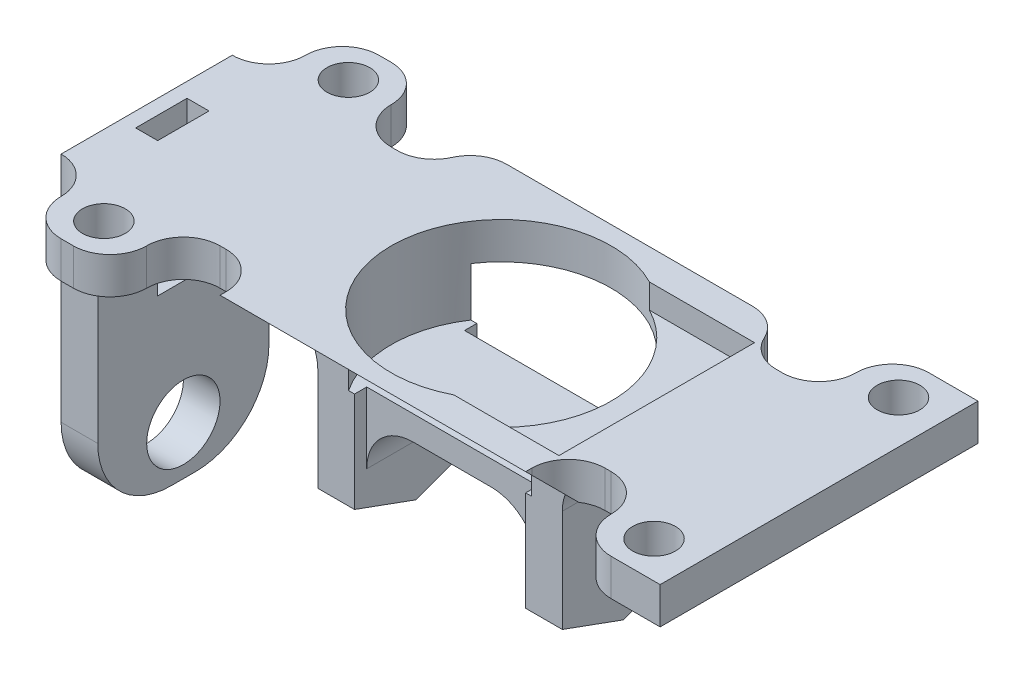
from build123d import *
from OCP.BRepFilletAPI import BRepFilletAPI_MakeChamfer

# Parameters (mm, degrees)
SKETCH1_W           = 3
SKETCH1_H           = 14
BOSS_EXTRUDE1_DEPTH = 25
SKETCH2_R           = 3
CUT_EXTRUDE1_DEPTH  = 27.134268691
SKETCH3_W           = 14
SKETCH3_H           = 3
BOSS_EXTRUDE2_DEPTH = 52
SKETCH4_W           = 3
SKETCH4_H           = 10
BOSS_EXTRUDE3_DEPTH = 14
CHAMFER1_SIZE       = 1.819851171
CHAMFER1_SIZE_2     = 5
SKETCH6_W           = 25
SKETCH6_H           = 3
BOSS_EXTRUDE5_DEPTH = 3.5
SKETCH5_W           = 7
SKETCH5_H           = 3
BOSS_EXTRUDE4_DEPTH = 6
SKETCH7_R           = 9
CUT_EXTRUDE2_DEPTH  = 7
CHAMFER2_SIZE       = 3
SKETCH8_W           = 8
SKETCH8_H           = 2
BOSS_EXTRUDE6_DEPTH = 14
SKETCH9_W           = 8.6
SKETCH9_H           = 16
CUT_EXTRUDE3_DEPTH  = 2
CUT_EXTRUDE4_REACH  = 62.467
SKETCH10_R          = 1.75
SKETCH11_W          = 1.8
SKETCH11_H          = 4.2
CUT_EXTRUDE5_DEPTH  = 11
FILLET1_R           = 3
FILLET2_R           = 3
FILLET3_R           = 3.8
FILLET4_R           = 6


# Some blends are built 0.0001 mm under size
with BuildPart() as part:
    # Sketch1 → Boss-Extrude1 (new body)
    with BuildSketch(Plane(origin=(0, 0, 0), x_dir=(1, 0, 0), z_dir=(0, 1, 0))):
        Rectangle(SKETCH1_W, SKETCH1_H)
    extrude(amount=BOSS_EXTRUDE1_DEPTH)

    # Sketch2 → Cut-Extrude1 (cut, through all)
    with BuildSketch(Plane.ZY.offset(1.5)):
        with Locations((0, 4)):
            Circle(SKETCH2_R)
    extrude(amount=-CUT_EXTRUDE1_DEPTH, mode=Mode.SUBTRACT)

    # Sketch3 → Boss-Extrude2 (add)
    with BuildSketch(Plane(origin=(1.5, 0, 0), x_dir=(0, 0, -1), z_dir=(1, 0, 0))):
        with Locations((0, 23.5)):
            Rectangle(SKETCH3_W, SKETCH3_H)
    extrude(amount=BOSS_EXTRUDE2_DEPTH)

    # Sketch4 → Boss-Extrude3 (add)
    with BuildSketch(Plane.XZ.offset(-22)):
        with Locations((36, 0)):
            Rectangle(SKETCH4_W, SKETCH4_H)
        with Locations((19, 0)):
            Rectangle(SKETCH4_W, SKETCH4_H)
    extrude(amount=BOSS_EXTRUDE3_DEPTH)

    # Chamfer1
    chamfer1_edges_1 = [part.edges().sort_by_distance(p)[0] for p in [
        (36, 8, -5),
    ]]
    chamfer1_side_1 = [part.faces().sort_by_distance(p)[0] for p in [
        (36, 8.036397023, -5),
    ]]
    chamfer1_edges_2 = [part.edges().sort_by_distance(p)[0] for p in [
        (36, 8, 5),
    ]]
    chamfer1_side_2 = [part.faces().sort_by_distance(p)[0] for p in [
        (36, 8.036397023, 5),
    ]]
    chamfer1_edges_3 = [part.edges().sort_by_distance(p)[0] for p in [
        (19, 8, 5),
    ]]
    chamfer1_side_3 = [part.faces().sort_by_distance(p)[0] for p in [
        (19, 8.036397023, 5),
    ]]
    chamfer1_edges_4 = [part.edges().sort_by_distance(p)[0] for p in [
        (19, 8, -5),
    ]]
    chamfer1_side_4 = [part.faces().sort_by_distance(p)[0] for p in [
        (19, 8.036397023, -5),
    ]]
    chamfer1 = BRepFilletAPI_MakeChamfer(part.part.solid().wrapped)
    for e in chamfer1_edges_1:
        chamfer1.Add(CHAMFER1_SIZE - 0.0001, CHAMFER1_SIZE_2 - 0.0001, e.wrapped, chamfer1_side_1[0].wrapped)
    for e in chamfer1_edges_2:
        chamfer1.Add(CHAMFER1_SIZE - 0.0001, CHAMFER1_SIZE_2 - 0.0001, e.wrapped, chamfer1_side_2[0].wrapped)
    for e in chamfer1_edges_3:
        chamfer1.Add(CHAMFER1_SIZE - 0.0001, CHAMFER1_SIZE_2 - 0.0001, e.wrapped, chamfer1_side_3[0].wrapped)
    for e in chamfer1_edges_4:
        chamfer1.Add(CHAMFER1_SIZE - 0.0001, CHAMFER1_SIZE_2 - 0.0001, e.wrapped, chamfer1_side_4[0].wrapped)
    add(Compound.cast(chamfer1.Shape()), mode=Mode.REPLACE)  # a hair under: the kernel refuses the full size

    # Sketch6 → Boss-Extrude5 (add)
    with BuildSketch(Plane(origin=(0, 0, -7), x_dir=(-1, 0, 0), z_dir=(0, 0, -1))):
        with Locations((-27.5, 23.5)):
            Rectangle(SKETCH6_W, SKETCH6_H)
    boss_extrude5 = extrude(amount=BOSS_EXTRUDE5_DEPTH)

    # Sketch5 → Boss-Extrude4 (add)
    with BuildSketch(Plane.XY.offset(7)):
        with Locations((5, 23.5)):
            Rectangle(SKETCH5_W, SKETCH5_H)
        with Locations((50, 23.5)):
            Rectangle(SKETCH5_W, SKETCH5_H)
    boss_extrude4 = extrude(amount=BOSS_EXTRUDE4_DEPTH)

    # Mirror1: Boss-Extrude5, Boss-Extrude4 across plane
    add(boss_extrude5.mirror(Plane.XY))
    add(boss_extrude4.mirror(Plane.XY))

    # Sketch7 → Cut-Extrude2 (cut)
    with BuildSketch(Plane(origin=(0, 25, 0), x_dir=(1, 0, 0), z_dir=(0, 1, 0))):
        with Locations(Location((27.5, 0, 0), (0, 0, 270))):
            Circle(SKETCH7_R)
    extrude(amount=-CUT_EXTRUDE2_DEPTH, mode=Mode.SUBTRACT)

    # Chamfer2
    # the kernel refuses this chamfer: 3 mm, written as the material it takes off along each edge
    with BuildSketch(Plane(origin=(15, 22, 10.5), x_dir=(0, -0.027495876610587926, -0.9996219169112968), z_dir=(1, 0, 0))) as chamfer2_piece_1:
        Polygon((CHAMFER2_SIZE * 0.999621916911, CHAMFER2_SIZE * 0.0274958766106), (-CHAMFER2_SIZE * 0.0274958766106, CHAMFER2_SIZE * 0.999621916911), (0, 0), align=None)
    extrude(amount=25, mode=Mode.SUBTRACT)

    # Sketch8 → Boss-Extrude6 (add)
    with BuildSketch(Plane(origin=(20.5, 0, 0), x_dir=(0, 0, -1), z_dir=(1, 0, 0))):
        with Locations((0, 17)):
            Rectangle(SKETCH8_W, SKETCH8_H)
    extrude(amount=BOSS_EXTRUDE6_DEPTH)

    # Sketch9 → Cut-Extrude3 (cut)
    with BuildSketch(Plane(origin=(0, 25, 0), x_dir=(1, 0, 0), z_dir=(0, 1, 0))):
        with Locations((35.923105626, 0)):
            Rectangle(SKETCH9_W, SKETCH9_H)
    extrude(amount=-CUT_EXTRUDE3_DEPTH, mode=Mode.SUBTRACT)

    # Sketch10 → Cut-Extrude4 (cut, up to next)
    with BuildSketch(Plane(origin=(0, 25, 0), x_dir=(1, 0, 0), z_dir=(0, 1, 0)), mode=Mode.PRIVATE) as cut_extrude4_sk1:
        with Locations(Location((5, -10, 0), (0, 0, 270))):
            Circle(SKETCH10_R)
    cut_extrude4_tool1 = extrude(cut_extrude4_sk1.sketch, amount=-CUT_EXTRUDE4_REACH, mode=Mode.PRIVATE) & part.part
    # Sketch10 → Cut-Extrude4 (cut, up to next)
    with BuildSketch(Plane(origin=(0, 25, 0), x_dir=(1, 0, 0), z_dir=(0, 1, 0)), mode=Mode.PRIVATE) as cut_extrude4_sk2:
        with Locations(Location((50, -10, 0), (0, 0, 270))):
            Circle(SKETCH10_R)
    cut_extrude4_tool2 = extrude(cut_extrude4_sk2.sketch, amount=-CUT_EXTRUDE4_REACH, mode=Mode.PRIVATE) & part.part
    # Sketch10 → Cut-Extrude4 (cut, up to next)
    with BuildSketch(Plane(origin=(0, 25, 0), x_dir=(1, 0, 0), z_dir=(0, 1, 0)), mode=Mode.PRIVATE) as cut_extrude4_sk3:
        with Locations(Location((50, 10, 0), (0, 0, 270))):
            Circle(SKETCH10_R)
    cut_extrude4_tool3 = extrude(cut_extrude4_sk3.sketch, amount=-CUT_EXTRUDE4_REACH, mode=Mode.PRIVATE) & part.part
    # Sketch10 → Cut-Extrude4 (cut, up to next)
    with BuildSketch(Plane(origin=(0, 25, 0), x_dir=(1, 0, 0), z_dir=(0, 1, 0)), mode=Mode.PRIVATE) as cut_extrude4_sk4:
        with Locations(Location((5, 10, 0), (0, 0, 270))):
            Circle(SKETCH10_R)
    cut_extrude4_tool4 = extrude(cut_extrude4_sk4.sketch, amount=-CUT_EXTRUDE4_REACH, mode=Mode.PRIVATE) & part.part
    add(cut_extrude4_tool1.solids().sort_by_distance((5, 25, 10))[0], mode=Mode.SUBTRACT)
    add(cut_extrude4_tool2.solids().sort_by_distance((50, 25, 10))[0], mode=Mode.SUBTRACT)
    add(cut_extrude4_tool3.solids().sort_by_distance((50, 25, -10))[0], mode=Mode.SUBTRACT)
    add(cut_extrude4_tool4.solids().sort_by_distance((5, 25, -10))[0], mode=Mode.SUBTRACT)

    # Sketch11 → Cut-Extrude5 (cut)
    with BuildSketch(Plane(origin=(0, 25, 0), x_dir=(1, 0, 0), z_dir=(0, 1, 0))):
        with Locations((0.6, 0)):
            Rectangle(SKETCH11_W, SKETCH11_H)
    extrude(amount=-CUT_EXTRUDE5_DEPTH, mode=Mode.SUBTRACT)

    # Fillet1
    # the kernel refuses this fillet: 3 mm, written as the material it adds along each edge
    with BuildSketch(Plane(origin=(46.5, 22, 7), x_dir=(0, 0, 1), z_dir=(0, 1, 0)), Plane(origin=(8.5, 25, 7), x_dir=(0, 0, 1), z_dir=(0, -1, 0)), Plane(origin=(1.5, 22, 7), x_dir=(0, 0, 1), z_dir=(0, 1, 0)), Plane(origin=(46.5, 22, -7), x_dir=(-1, 0, 0), z_dir=(0, 1, 0))) as fillet1_piece_1:
        with BuildLine():
            CenterArc((FILLET1_R, -FILLET1_R), FILLET1_R, 90, 90)
            Line((0, -FILLET1_R), (0, 0))
            Line((0, 0), (FILLET1_R, 0))
        make_face()
    extrude(amount=3)
    with BuildSketch(Plane(origin=(40, 22, 7), x_dir=(1, 0, 0), z_dir=(0, 1, 0))) as fillet1_piece_2_section:
        with BuildLine():
            CenterArc((FILLET1_R, -FILLET1_R), FILLET1_R, 90, 90)
            Line((0, -FILLET1_R), (0, 0))
            Line((0, 0), (FILLET1_R, 0))
        make_face()
    fillet1_piece_2 = extrude(amount=8.5, mode=Mode.PRIVATE)
    fillet1_piece_2 = split(fillet1_piece_2, bisect_by=Plane(origin=(40.974089344, 22.187586332, 7.687586332), z_dir=(0, 0.7071067811862648, -0.7071067811868302)), keep=Keep.TOP, mode=Mode.PRIVATE)
    fillet1_piece_2 = split(fillet1_piece_2, bisect_by=Plane(origin=(40.974089344, 25, 7.348410065), z_dir=(0, -1, 0)), keep=Keep.TOP, mode=Mode.PRIVATE)
    fillet1_piece_2 = split(fillet1_piece_2, bisect_by=Plane(origin=(40.223105626, 22.526762599, 7.348410065), z_dir=(1, 0, 0)), keep=Keep.TOP, mode=Mode.PRIVATE)
    add(fillet1_piece_2)
    with BuildSketch(Plane(origin=(40, 22, 7), x_dir=(1, 0, 0), z_dir=(0, 1, 0))) as fillet1_piece_3_section:
        with BuildLine():
            CenterArc((FILLET1_R, -FILLET1_R), FILLET1_R, 90, 90)
            Line((0, -FILLET1_R), (0, 0))
            Line((0, 0), (FILLET1_R, 0))
        make_face()
    fillet1_piece_3 = extrude(amount=1, mode=Mode.PRIVATE)
    fillet1_piece_3 = split(fillet1_piece_3, bisect_by=Plane(origin=(40.111552813, 22.25, 7.75), z_dir=(0, 0.7071067811862648, -0.7071067811868302)), keep=Keep.TOP, mode=Mode.PRIVATE)
    add(fillet1_piece_3)
    with BuildSketch(Plane(origin=(40, 14.5, 7), x_dir=(1, 0, 0), z_dir=(0, 1, 0))) as fillet1_piece_4_section:
        with BuildLine():
            CenterArc((FILLET1_R, -FILLET1_R), FILLET1_R, 90, 90)
            Line((0, -FILLET1_R), (0, 0))
            Line((0, 0), (FILLET1_R, 0))
        make_face()
    fillet1_piece_4 = extrude(amount=16, mode=Mode.PRIVATE)
    fillet1_piece_4 = split(fillet1_piece_4, bisect_by=Plane(origin=(40.102150249, 23.589388324, 9.089388324), z_dir=(0, 0.7071067811862648, -0.7071067811868302)), keep=Keep.TOP, mode=Mode.PRIVATE)
    fillet1_piece_4 = split(fillet1_piece_4, bisect_by=Plane(origin=(40.102150249, 25, 8.580734209), z_dir=(0, -1, 0)), keep=Keep.TOP, mode=Mode.PRIVATE)
    fillet1_piece_4 = split(fillet1_piece_4, bisect_by=Plane(origin=(40.102150249, 24.098042439, 8), z_dir=(0, 0, 1)), keep=Keep.TOP, mode=Mode.PRIVATE)
    add(fillet1_piece_4)
    with BuildSketch(Plane(origin=(15, 25, 7), x_dir=(-1, 0, 0), z_dir=(0, -1, 0))) as fillet1_piece_5_section:
        with BuildLine():
            CenterArc((FILLET1_R, -FILLET1_R), FILLET1_R, 90, 90)
            Line((0, -FILLET1_R), (0, 0))
            Line((0, 0), (FILLET1_R, 0))
        make_face()
    fillet1_piece_5 = extrude(amount=3, mode=Mode.PRIVATE)
    fillet1_piece_5 = split(fillet1_piece_5, bisect_by=Plane(origin=(14.281357865, 22.846943588, 8.346943588), z_dir=(0, 0.7071067811862648, -0.7071067811868302)), keep=Keep.TOP, mode=Mode.PRIVATE)
    add(fillet1_piece_5)
    with BuildSketch(Plane(origin=(1.5, 22, -7), x_dir=(0, 0, -1), z_dir=(0, 1, 0)), Plane(origin=(8.5, 25, -7), x_dir=(0, 0, -1), z_dir=(0, -1, 0)), Plane(origin=(15, 25, -7), x_dir=(-1, 0, 0), z_dir=(0, -1, 0))) as fillet1_piece_6:
        with BuildLine():
            CenterArc((FILLET1_R, FILLET1_R), FILLET1_R, 180, 90)
            Line((0, FILLET1_R), (0, 0))
            Line((0, 0), (FILLET1_R, 0))
        make_face()
    extrude(amount=3)
    with BuildSketch(Plane(origin=(40, 22, -7), x_dir=(0, 0, -1), z_dir=(0, 1, 0))) as fillet1_piece_7_section:
        with BuildLine():
            CenterArc((FILLET1_R, -FILLET1_R), FILLET1_R, 90, 90)
            Line((0, -FILLET1_R), (0, 0))
            Line((0, 0), (FILLET1_R, 0))
        make_face()
    fillet1_piece_7 = extrude(amount=8.5, mode=Mode.PRIVATE)
    fillet1_piece_7 = split(fillet1_piece_7, bisect_by=Plane(origin=(40.097980222, 25, -8.647383522), z_dir=(0, -1, 0)), keep=Keep.TOP, mode=Mode.PRIVATE)
    fillet1_piece_7 = split(fillet1_piece_7, bisect_by=Plane(origin=(40.097980222, 22.5, -8), z_dir=(0, 0, -1)), keep=Keep.TOP, mode=Mode.PRIVATE)
    add(fillet1_piece_7)
    with BuildSketch(Plane(origin=(40, 22, -7), x_dir=(0, 0, -1), z_dir=(0, 1, 0))) as fillet1_piece_8:
        with BuildLine():
            CenterArc((FILLET1_R, -FILLET1_R), FILLET1_R, 90, 90)
            Line((0, -FILLET1_R), (0, 0))
            Line((0, 0), (FILLET1_R, 0))
        make_face()
    extrude(amount=1)
    with BuildSketch(Plane(origin=(40, 14.5, -7), x_dir=(0, 0, -1), z_dir=(0, 1, 0))) as fillet1_piece_9_section:
        with BuildLine():
            CenterArc((FILLET1_R, -FILLET1_R), FILLET1_R, 90, 90)
            Line((0, -FILLET1_R), (0, 0))
            Line((0, 0), (FILLET1_R, 0))
        make_face()
    fillet1_piece_9 = extrude(amount=16, mode=Mode.PRIVATE)
    fillet1_piece_9 = split(fillet1_piece_9, bisect_by=Plane(origin=(40.946316816, 25, -7.381877422), z_dir=(0, -1, 0)), keep=Keep.TOP, mode=Mode.PRIVATE)
    fillet1_piece_9 = split(fillet1_piece_9, bisect_by=Plane(origin=(40.946316816, 23, -7.381877422), z_dir=(0, 1, 0)), keep=Keep.TOP, mode=Mode.PRIVATE)
    fillet1_piece_9 = split(fillet1_piece_9, bisect_by=Plane(origin=(40.223105626, 24, -7.381877422), z_dir=(1, 0, 0)), keep=Keep.TOP, mode=Mode.PRIVATE)
    add(fillet1_piece_9)

    # Fillet2
    fillet2_edges = [part.edges().sort_by_distance(p)[0] for p in [
        (46.5, 23.5, 13),
        (46.5, 23.5, -13),
        (40, 23.5, -10.5),
        (15, 23.5, -10.5),
        (8.5, 23.5, 13),
        (1.5, 23.5, 13),
        (1.5, 23.5, -13),
        (8.5, 23.5, -13),
    ]]
    fillet(fillet2_edges, radius=FILLET2_R - 0.0001)  # a hair under: the kernel refuses the full size

    # Fillet3
    fillet3_edges = [part.edges().sort_by_distance(p)[0] for p in [
        (20.5, 16, 0),
        (34.5, 16, 0),
        (1.5, 22, 4.55),
        (1.5, 22, -4.55),
        (17.5, 22, 0),
        (37.5, 22, 0),
    ]]
    fillet(fillet3_edges, radius=FILLET3_R)

    # Fillet4
    fillet4_edges = [part.edges().sort_by_distance(p)[0] for p in [
        (0, 0, 7),
        (0, 0, -7),
    ]]
    fillet(fillet4_edges, radius=FILLET4_R)


solid = part.part
